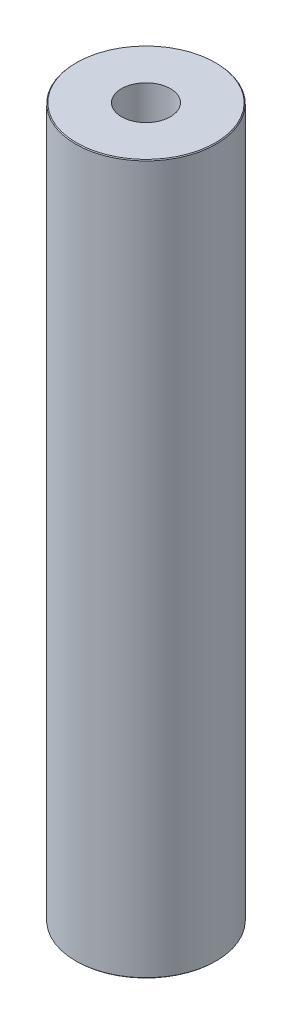
from build123d import *

# Parameters (mm, degrees)
SKETCH1_R           = 45
BOSS_EXTRUDE1_DEPTH = 454.226625745
SKETCH2_R           = 15.646938019
CUT_EXTRUDE1_DEPTH  = 459.663087174
CHAMFER1_SIZE       = 0.507776997


with BuildPart() as part:
    # Sketch1 → Boss-Extrude1 (new body)
    with BuildSketch(Plane(origin=(0, 0, 0), x_dir=(1, 0, 0), z_dir=(0, 1, 0))):
        Circle(SKETCH1_R)
    extrude(amount=BOSS_EXTRUDE1_DEPTH)

    # Sketch2 → Cut-Extrude1 (cut, through all)
    with BuildSketch(Plane(origin=(0, 0, 0), x_dir=(1, 0, 0), z_dir=(0, 1, 0))):
        Circle(SKETCH2_R)
    extrude(amount=CUT_EXTRUDE1_DEPTH, mode=Mode.SUBTRACT)

    # Chamfer1
    chamfer1_edges = [part.edges().sort_by_distance(p)[0] for p in [
        (-45, 454.226625745, 0),
        (-45, 0, 0),
    ]]
    chamfer(chamfer1_edges, length=CHAMFER1_SIZE)


solid = part.part
